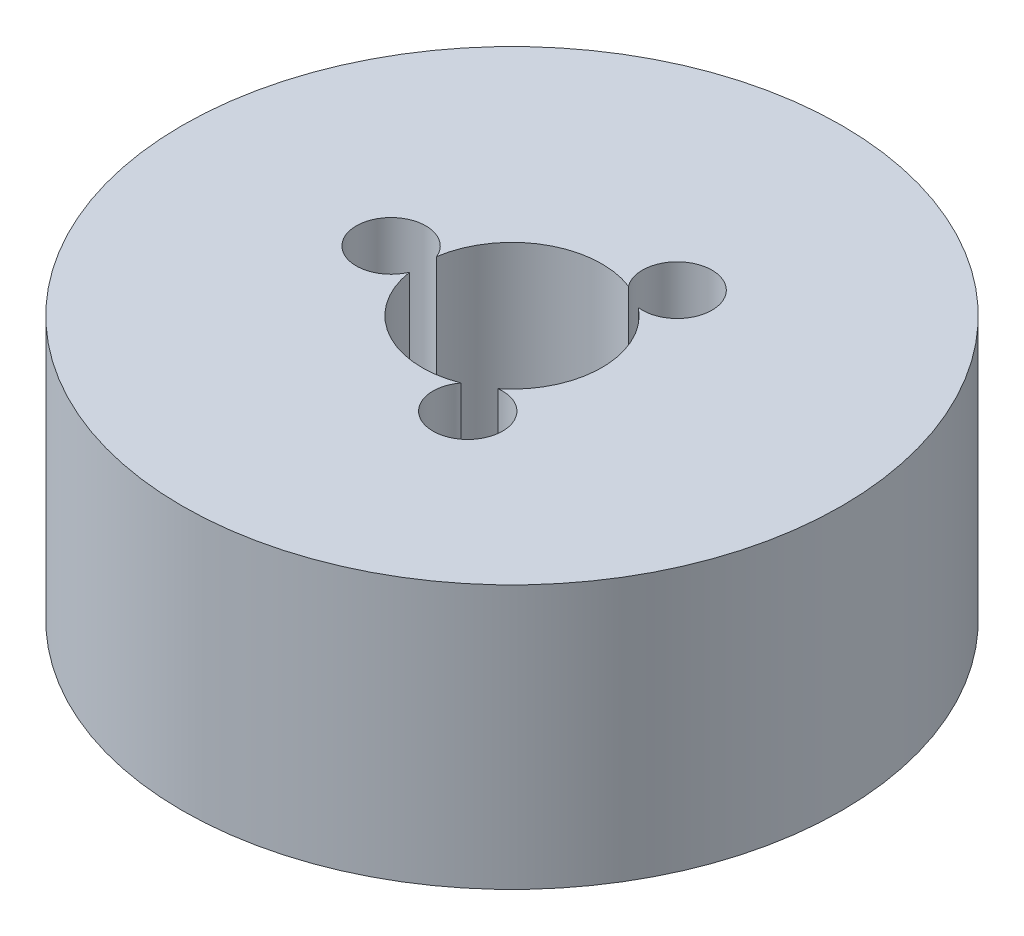
from build123d import *

# Parameters (mm, degrees)
SKETCH1_R           = 27.5
BOSS_EXTRUDE1_DEPTH = 22
SKETCH2_R           = 7.5
CUT_EXTRUDE1_DEPTH  = 45.682211225
SKETCH3_R           = 2.901166918
CUT_EXTRUDE2_DEPTH  = 13.931844884
CIRPATTERN1_COUNT   = 3


with BuildPart() as part:
    # Sketch1 → Boss-Extrude1 (new body)
    with BuildSketch(Plane(origin=(0, 0, 0), x_dir=(1, 0, 0), z_dir=(0, 1, 0))):
        Circle(SKETCH1_R)
    extrude(amount=BOSS_EXTRUDE1_DEPTH)

    # Sketch2 → Cut-Extrude1 (cut, through all)
    with BuildSketch(Plane(origin=(0, 0, 0), x_dir=(1, 0, 0), z_dir=(0, 1, 0))):
        Circle(SKETCH2_R)
    extrude(amount=CUT_EXTRUDE1_DEPTH, mode=Mode.SUBTRACT)

    # Sketch3 → Cut-Extrude2 (cut)
    with BuildSketch(Plane(origin=(0, 22, 0), x_dir=(1, 0, 0), z_dir=(0, 1, 0))):
        with Locations((-10.086307096, 0)):
            Circle(SKETCH3_R)
    cut_extrude2 = extrude(amount=-CUT_EXTRUDE2_DEPTH, mode=Mode.SUBTRACT)

    # CirPattern1: Cut-Extrude2 ×3 about axis
    cirpattern1_axis = Axis((0, 0, 0), (0, 1, 0))
    for i in range(1, CIRPATTERN1_COUNT):
        add(cut_extrude2.rotate(cirpattern1_axis, i * 360 / CIRPATTERN1_COUNT), mode=Mode.SUBTRACT)


solid = part.part
